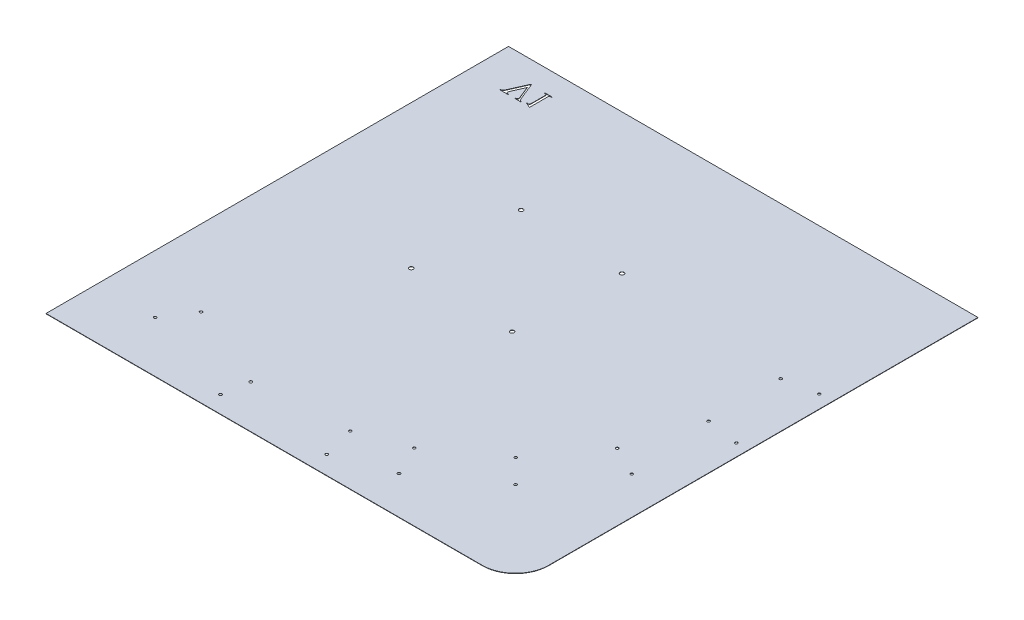
from build123d import *

# Parameters (mm, degrees)
SKETCH_1_R             = 2
SKETCH_1_R_2           = 2.1
SKETCH_1_R_3           = 3
SM_BASE_FLANGE_1_DEPTH = 0.5
CUT_EXTRUDE_1_DEPTH    = 10


# Sheet-metal steps are written as plain solids
with BuildPart() as part:
    # Sketch 1 → Базовая кромка1 (new body)
    with BuildSketch(Plane(origin=(0, 0, 0), x_dir=(-1, 0, 0), z_dir=(0, 1, 0))):
        with BuildLine():
            Line((320.461059476, -56.028158177), (-387.642079341, -56.028158177))
            Line((-387.642079341, -56.028158177), (-387.642079341, 591.618667046))
            ThreePointArc((-387.642079341, 591.618667046), (-372.9974184, 626.974006105), (-337.642079341, 641.618667046))
            Line((-337.642079341, 641.618667046), (320.461059476, 641.618667046))
            Line((320.461059476, 641.618667046), (320.461059476, -56.028158177))
        make_face()
        with Locations(Location((232.901780581, 564.453118264, 0), (0, 0, 90))):
            Circle(SKETCH_1_R, mode=Mode.SUBTRACT)
        with Locations(Location((205.574652668, 522.576074481, 0), (0, 0, 90))):
            Circle(SKETCH_1_R, mode=Mode.SUBTRACT)
        with Locations(Location((76.758312789, 576.517850099, 0), (0, 0, 90))):
            Circle(SKETCH_1_R_2, mode=Mode.SUBTRACT)
        with Locations(Location((83.103047022, 616.011448916, 0), (0, 0, 90))):
            Circle(SKETCH_1_R_2, mode=Mode.SUBTRACT)
        with Locations(Location((-62.471713971, 565.638317713, 0), (0, 0, 90))):
            Circle(SKETCH_1_R, mode=Mode.SUBTRACT)
        with Locations(Location((-75.307004693, 613.967543116, 0), (0, 0, 90))):
            Circle(SKETCH_1_R, mode=Mode.SUBTRACT)
        with Locations(Location((-154.905231477, 584.498280208, 0), (0, 0, 90))):
            Circle(SKETCH_1_R, mode=Mode.SUBTRACT)
        with Locations(Location((-132.925313212, 539.586955948, 0), (0, 0, 90))):
            Circle(SKETCH_1_R, mode=Mode.SUBTRACT)
        with Locations(Location((-257.23805391, 511.080832587, 0), (0, 0, 90))):
            Circle(SKETCH_1_R, mode=Mode.SUBTRACT)
        with Locations(Location((-221.98742832, 475.621089278, 0), (0, 0, 90))):
            Circle(SKETCH_1_R, mode=Mode.SUBTRACT)
        with Locations(Location((-331.054363434, 409.589144393, 0), (0, 0, 90))):
            Circle(SKETCH_1_R, mode=Mode.SUBTRACT)
        with Locations(Location((-286.459901196, 386.976450223, 0), (0, 0, 90))):
            Circle(SKETCH_1_R, mode=Mode.SUBTRACT)
        with Locations(Location((-319.872468675, 282.582139428, 0), (0, 0, 90))):
            Circle(SKETCH_1_R, mode=Mode.SUBTRACT)
        with Locations(Location((-369.309331997, 290.065223337, 0), (0, 0, 90))):
            Circle(SKETCH_1_R, mode=Mode.SUBTRACT)
        with Locations(Location((-367.98492513, 163.662251503, 0), (0, 0, 90))):
            Circle(SKETCH_1_R, mode=Mode.SUBTRACT)
        with Locations(Location((-318.822959797, 172.803360874, 0), (0, 0, 90))):
            Circle(SKETCH_1_R, mode=Mode.SUBTRACT)
        with Locations(Location((-54.834101722, 313.826443363, 0), (0, 0, 90))):
            Circle(SKETCH_1_R_3, mode=Mode.SUBTRACT)
        with Locations(Location((104.119471165, 307.024850425, 0), (0, 0, 90))):
            Circle(SKETCH_1_R_3, mode=Mode.SUBTRACT)
        with Locations(Location((-61.635694659, 154.872870476, 0), (0, 0, 90))):
            Circle(SKETCH_1_R_3, mode=Mode.SUBTRACT)
        with Locations(Location((97.317878227, 148.071277538, 0), (0, 0, 90))):
            Circle(SKETCH_1_R_3, mode=Mode.SUBTRACT)
    extrude(amount=-SM_BASE_FLANGE_1_DEPTH)

    # Эскиз2 → Вырез-Вытянуть1 (cut)
    with BuildSketch(Plane.XZ.offset(0.5)):
        with BuildLine():
            Line((-238.638607967, 7.24420169), (-238.638607967, 6.410868357))
            add(Edge.make_bspline(
                [(-238.638607967, 6.410868357), (-238.887920943, 6.356531892), (-239.361698003, 6.253274648), (-240.010014158, 6.005844395), (-240.579687398, 5.723720139), (-240.886811511, 5.462306893), (-241.034441301, 5.336649607)],
                knots=[0, 0, 0, 0, 1.150087553, 2.185546491, 3.127820389, 4, 4, 4, 4], degree=3))
            add(Edge.make_bspline(
                [(-241.034441301, 5.336649607), (-241.2289233, 5.124217162), (-241.639086939, 4.676195933), (-242.171400324, 3.865633151), (-242.660242043, 2.904728338), (-242.947252605, 2.203138475), (-243.098243384, 1.83404544)],
                knots=[0, 0, 0, 0, 0.843279275, 1.778480768, 2.831301136, 4, 4, 4, 4], degree=3))
            Line((-243.098243384, 1.83404544), (-253.059180884, -23.172464977))
            Line((-253.059180884, -23.172464977), (-254.315691301, -23.172464977))
            Line((-254.315691301, -23.172464977), (-265.565691301, 2.30279544))
            add(Edge.make_bspline(
                [(-265.565691301, 2.30279544), (-265.635204754, 2.465519316), (-265.766956018, 2.773935533), (-265.952964924, 3.212394285), (-266.133429648, 3.595545189), (-266.283015563, 3.93731222), (-266.436601122, 4.218736379), (-266.559636482, 4.457816164), (-266.666293014, 4.647652778), (-266.743219764, 4.751280041), (-266.776628801, 4.796285023)],
                knots=[0, 0, 0, 0, 1.529564973, 2.899037637, 4.116150385, 5.19045313, 6.121771619, 6.885345418, 7.515909146, 8, 8, 8, 8], degree=3))
            add(Edge.make_bspline(
                [(-266.776628801, 4.796285023), (-266.868701796, 4.912374251), (-267.051699637, 5.143105075), (-267.386057338, 5.430872282), (-267.735723563, 5.700019464), (-268.136179251, 5.912951287), (-268.578527638, 6.101354992), (-269.089078885, 6.240636623), (-269.665685062, 6.351965832), (-270.076911817, 6.39062447), (-270.292253801, 6.410868357)],
                knots=[0, 0, 0, 0, 0.887556751, 1.764045677, 2.639662523, 3.531893419, 4.478056563, 5.521497236, 6.702113387, 8, 8, 8, 8], degree=3))
            Line((-270.292253801, 6.410868357), (-270.292253801, 7.24420169))
            Line((-270.292253801, 7.24420169), (-258.098243384, 7.24420169))
            Line((-258.098243384, 7.24420169), (-258.098243384, 6.410868357))
            add(Edge.make_bspline(
                [(-258.098243384, 6.410868357), (-258.413985072, 6.378312804), (-258.986151491, 6.319317763), (-259.748984223, 6.152113961), (-260.343542999, 5.976223328), (-260.769740392, 5.731057073), (-261.062182725, 5.450195949), (-261.25307777, 5.134032333), (-261.379383471, 4.786033635), (-261.392352386, 4.539174533), (-261.399024634, 4.41217044)],
                knots=[0, 0, 0, 0, 1.777170112, 3.220471342, 4.374353576, 5.235867464, 5.949763295, 6.621486191, 7.290782096, 8, 8, 8, 8], degree=3))
            add(Edge.make_bspline(
                [(-261.399024634, 4.41217044), (-261.397140976, 4.314284552), (-261.393098531, 4.104215504), (-261.332225013, 3.77264945), (-261.256853901, 3.400284886), (-261.143486252, 2.990113081), (-261.00001471, 2.540624798), (-260.822719603, 2.055591395), (-260.62118426, 1.528353146), (-260.46518273, 1.169374033), (-260.383399634, 0.981180857)],
                knots=[0, 0, 0, 0, 0.652058758, 1.399357611, 2.242571281, 3.187172578, 4.235551921, 5.389454952, 6.631433566, 8, 8, 8, 8], degree=3))
            Line((-260.383399634, 0.981180857), (-252.675066301, -16.48626706))
            Line((-252.675066301, -16.48626706), (-245.800066301, 0.75982669))
            add(Edge.make_bspline(
                [(-245.800066301, 0.75982669), (-245.719454387, 0.963693639), (-245.564591609, 1.35534049), (-245.348124186, 1.91746745), (-245.170572247, 2.434558038), (-245.031072342, 2.902939803), (-244.905731089, 3.31904924), (-244.83369646, 3.690551992), (-244.771138753, 4.010810181), (-244.766868285, 4.210105839), (-244.764910051, 4.301493357)],
                knots=[0, 0, 0, 0, 1.419640579, 2.727257979, 3.900501837, 4.958504646, 5.892797517, 6.711382607, 7.409101305, 8, 8, 8, 8], degree=3))
            add(Edge.make_bspline(
                [(-244.764910051, 4.301493357), (-244.773002004, 4.406577173), (-244.789669431, 4.623023904), (-244.913274914, 4.94179987), (-245.125052837, 5.243363405), (-245.406706082, 5.540589582), (-245.789411534, 5.814470824), (-246.284715527, 6.033295875), (-246.882233857, 6.224733044), (-247.32217895, 6.303542276), (-247.557878801, 6.34576419)],
                knots=[0, 0, 0, 0, 0.671790012, 1.383721652, 2.154073914, 3.018455332, 3.993555146, 5.14295437, 6.469342564, 8, 8, 8, 8], degree=3))
            add(Edge.make_bspline(
                [(-247.557878801, 6.34576419), (-247.607796371, 6.354419769), (-247.731537217, 6.375876117), (-247.855197399, 6.397792897), (-247.928972551, 6.410868357)],
                knots=[0, 0, 0, 0, 0.806808289, 2, 2, 2, 2], degree=3))
            Line((-247.928972551, 6.410868357), (-247.928972551, 7.24420169))
            Line((-247.928972551, 7.24420169), (-238.638607967, 7.24420169))
        make_face()
        with BuildLine():
            Line((-232.883399634, 4.327535023), (-225.715430884, 7.660868357))
            Line((-225.715430884, 7.660868357), (-224.966732967, 7.660868357))
            Line((-224.966732967, 7.660868357), (-224.966732967, -17.339131643))
            add(Edge.make_bspline(
                [(-224.966732967, -17.339131643), (-224.964148451, -17.54528094), (-224.95925144, -17.935882153), (-224.958633965, -18.491735024), (-224.933277629, -18.984019608), (-224.920909697, -19.416687861), (-224.88259517, -19.787038272), (-224.857215008, -20.101229384), (-224.809267684, -20.352343137), (-224.753628113, -20.606227792), (-224.638966485, -20.865803418), (-224.444470946, -21.132977798), (-224.193169184, -21.360565096), (-223.873304192, -21.566700932), (-223.430002155, -21.711467683), (-222.842582632, -21.823796867), (-222.086326505, -21.896090628), (-221.525041669, -21.913114124), (-221.216732967, -21.922464977)],
                knots=[0, 0, 0, 0, 1.356933168, 2.571048021, 3.657379777, 4.601012336, 5.418253307, 6.107533085, 6.673460353, 7.099554724, 7.815972102, 8.521630774, 9.259509655, 10.036179522, 11.007509208, 12.304408113, 13.970044684, 16, 16, 16, 16], degree=3))
            Line((-221.216732967, -21.922464977), (-221.216732967, -22.75579831))
            Line((-221.216732967, -22.75579831), (-232.466732967, -22.75579831))
            Line((-232.466732967, -22.75579831), (-232.466732967, -21.922464977))
            add(Edge.make_bspline(
                [(-232.466732967, -21.922464977), (-232.151863023, -21.913523284), (-231.581811158, -21.897334923), (-230.819934057, -21.821831214), (-230.240092303, -21.720846522), (-229.81377244, -21.579301172), (-229.519367415, -21.377773106), (-229.27885518, -21.172435319), (-229.095780994, -20.929650127), (-228.964891948, -20.7035562), (-228.888486982, -20.472060194), (-228.849905789, -20.225912454), (-228.800033291, -19.914373104), (-228.773154421, -19.531179636), (-228.746566357, -19.079861376), (-228.725928909, -18.561090593), (-228.723876471, -17.972799021), (-228.719203827, -17.558310254), (-228.716732967, -17.339131643)],
                knots=[0, 0, 0, 0, 2.071302469, 3.74996044, 5.029173581, 5.941282905, 6.673651071, 7.361112001, 8.012044112, 8.663601818, 9.069808009, 9.607263055, 10.29959599, 11.144699654, 12.131164582, 13.273777592, 14.558393644, 16, 16, 16, 16], degree=3))
            Line((-228.716732967, -17.339131643), (-228.716732967, -1.089131643))
            add(Edge.make_bspline(
                [(-228.716732967, -1.089131643), (-228.715279115, -0.846057441), (-228.712500965, -0.381569541), (-228.731302282, 0.282341543), (-228.737111547, 0.87956103), (-228.769261199, 1.406458806), (-228.787994037, 1.865349032), (-228.832506476, 2.252939392), (-228.8636868, 2.576296711), (-228.906121867, 2.765295196), (-228.925066301, 2.84967044)],
                knots=[0, 0, 0, 0, 1.476765178, 2.821934835, 4.035278551, 5.104597693, 6.029081604, 6.824151588, 7.47506195, 8, 8, 8, 8], degree=3))
            add(Edge.make_bspline(
                [(-228.925066301, 2.84967044), (-228.952689863, 2.954723148), (-229.005051556, 3.153855234), (-229.123423276, 3.427209831), (-229.274382335, 3.659749118), (-229.513782692, 3.907751047), (-229.891300331, 4.132081268), (-230.230263351, 4.162367602), (-230.402930884, 4.17779544)],
                knots=[0, 0, 0, 0, 0.903062441, 1.711795068, 2.468214314, 3.196286531, 4.571790261, 6, 6, 6, 6], degree=3))
            add(Edge.make_bspline(
                [(-230.402930884, 4.17779544), (-230.54453314, 4.166231248), (-230.8600213, 4.140466365), (-231.36774428, 4.00870525), (-231.948948677, 3.78818148), (-232.353075019, 3.597161632), (-232.570899634, 3.49420169)],
                knots=[0, 0, 0, 0, 0.743837888, 1.657262055, 2.737261251, 4, 4, 4, 4], degree=3))
            Line((-232.570899634, 3.49420169), (-232.883399634, 4.327535023))
        make_face()
    extrude(amount=-CUT_EXTRUDE_1_DEPTH, mode=Mode.SUBTRACT)


solid = part.part
